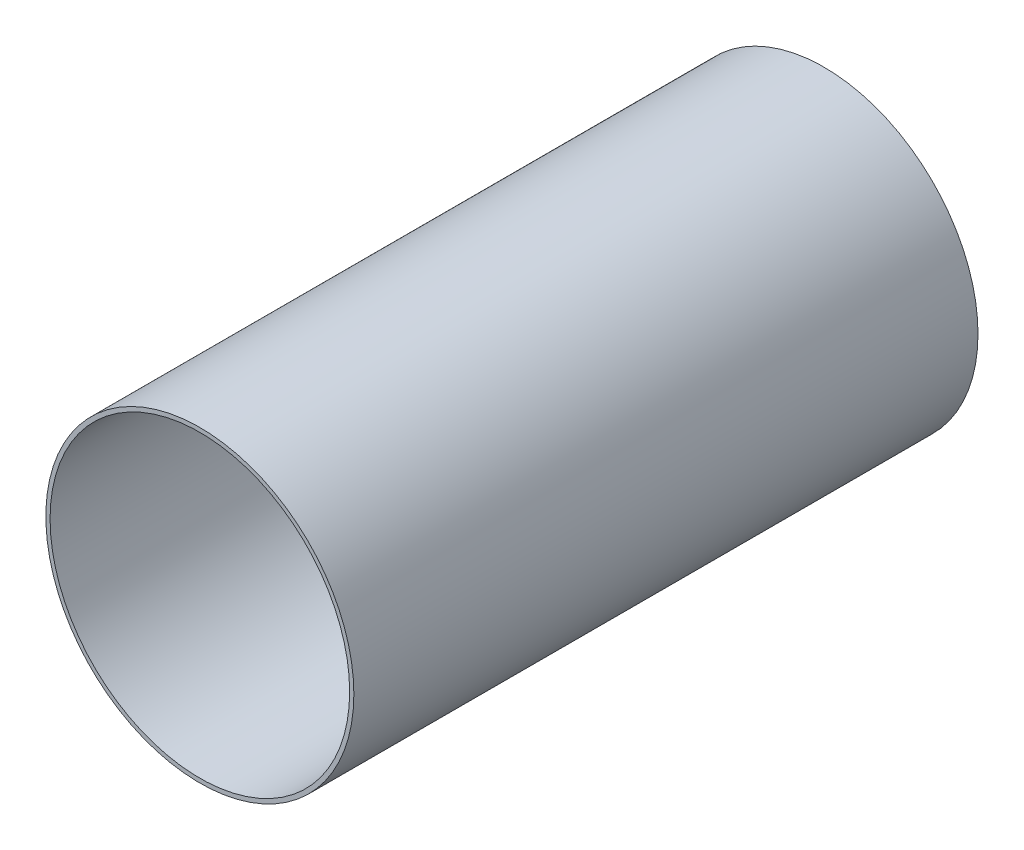
from build123d import *

# Parameters (mm, degrees)
SKETCH1_R           = 49.35
SKETCH1_R_2         = 48
BOSS_EXTRUDE1_DEPTH = 200


with BuildPart() as part:
    # Sketch1 → Boss-Extrude1 (new body)
    with BuildSketch(Plane(origin=(0, 0, 0), x_dir=(0, 1, 0), z_dir=(0, 0, 1))):
        Circle(SKETCH1_R)
        Circle(SKETCH1_R_2, mode=Mode.SUBTRACT)
    extrude(amount=BOSS_EXTRUDE1_DEPTH)


solid = part.part
